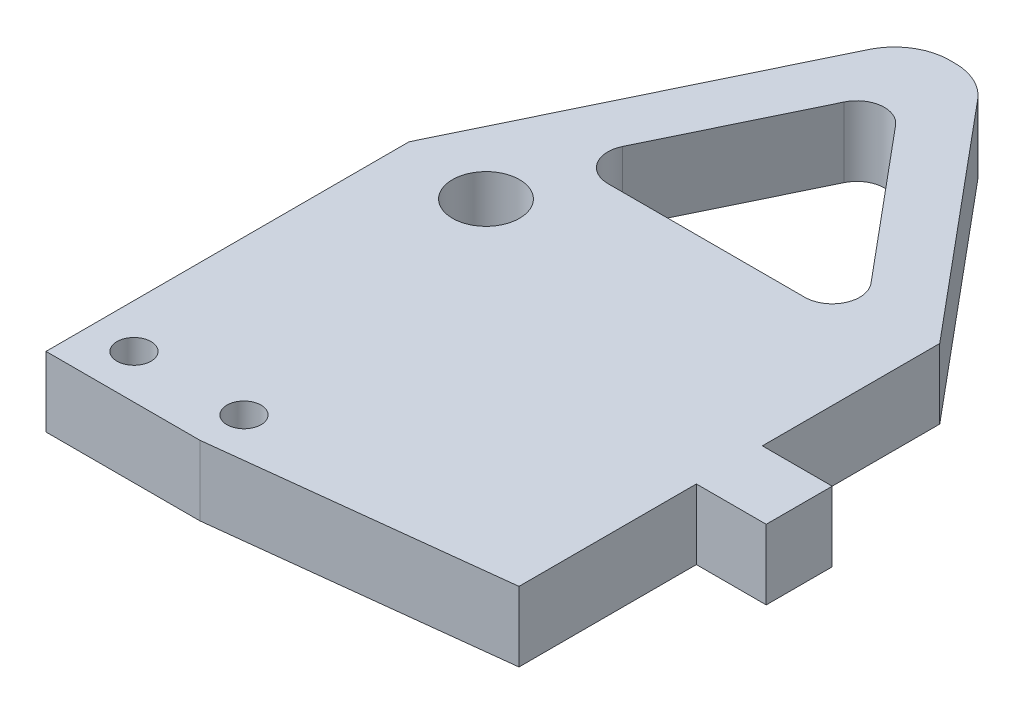
from build123d import *

# Parameters (mm, degrees)
SKETCH1_R           = 6.1
SKETCH1_R_2         = 3.1
BOSS_EXTRUDE1_DEPTH = 12.7
FILLET1_R           = 10
CUT_EXTRUDE1_DEPTH  = 147.442104601
FILLET2_R           = 5


with BuildPart() as part:
    # Sketch1 → Boss-Extrude1 (new body)
    with BuildSketch(Plane(origin=(0, 0, 0), x_dir=(1, 0, 0), z_dir=(0, 1, 0))):
        Polygon((-80, 0), (-80, 60), (-50, 122), (-38, 122), (0, 76.5), (0, 44.25), (12.7, 44.25), (12.7, 32.25), (0, 32.25), (0, 0), (-52, -6), (-80, -6), align=None)
        with Locations((-64, 58)):
            Circle(SKETCH1_R, mode=Mode.SUBTRACT)
        with Locations((-72, 2)):
            Circle(SKETCH1_R_2, mode=Mode.SUBTRACT)
        with Locations((-52, 2)):
            Circle(SKETCH1_R_2, mode=Mode.SUBTRACT)
    extrude(amount=BOSS_EXTRUDE1_DEPTH)

    # Fillet1
    fillet1_edges = [part.edges().sort_by_distance(p)[0] for p in [
        (-38, 6.35, -122),
        (-50, 6.35, -122),
    ]]
    fillet(fillet1_edges, radius=FILLET1_R)

    # Sketch3 → Cut-Extrude1 (cut, through all)
    with BuildSketch(Plane(origin=(0, 12.7, 0), x_dir=(1, 0, 0), z_dir=(0, 1, 0))):
        Polygon((-8.852991204, 71.5), (-43.343506167, 112.797853444), (-63.326338479, 71.5), align=None)
    extrude(amount=-CUT_EXTRUDE1_DEPTH, mode=Mode.SUBTRACT)

    # Fillet2
    fillet2_edges = [part.edges().sort_by_distance(p)[0] for p in [
        (-43.343506167, 6.35, -112.797853444),
        (-8.852991204, 6.35, -71.5),
        (-63.326338479, 6.35, -71.5),
    ]]
    fillet(fillet2_edges, radius=FILLET2_R)


solid = part.part
